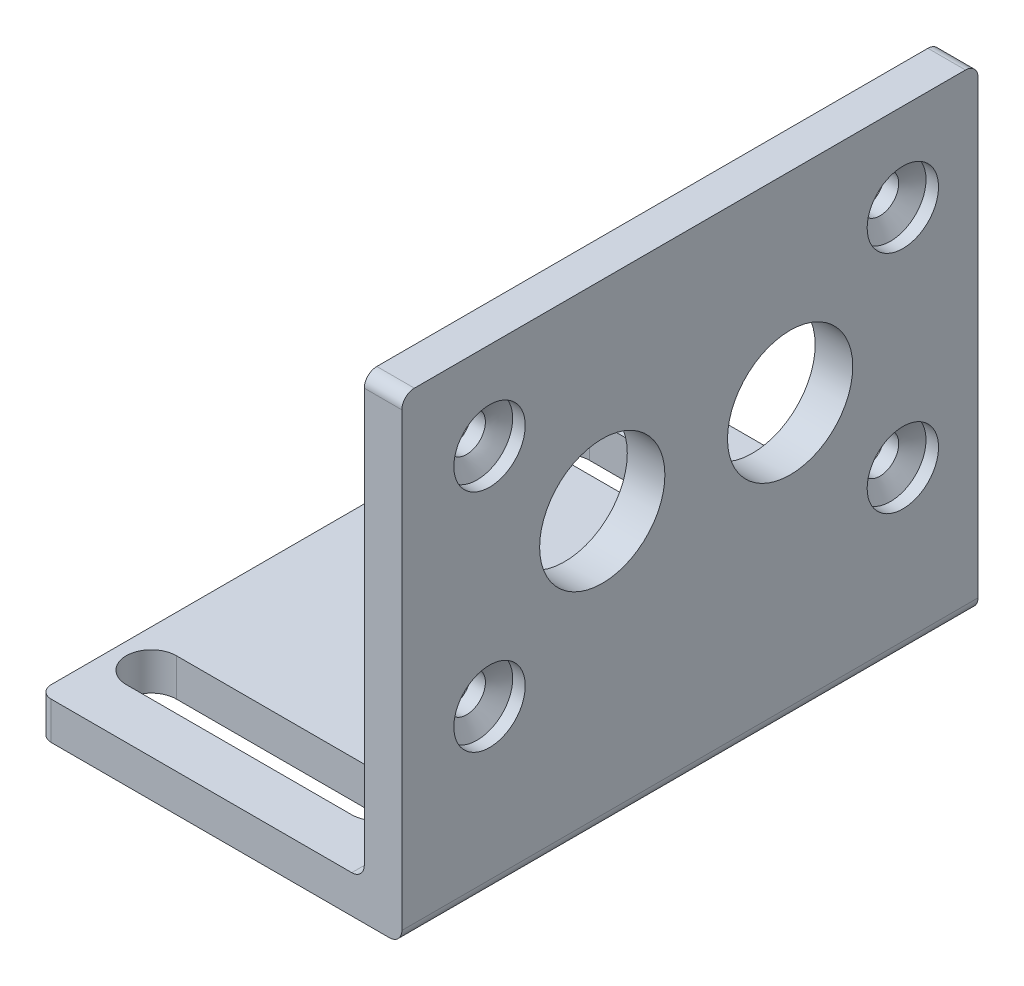
from build123d import *

# Parameters (mm, degrees)
SALIENTE_EXTRUIR1_DEPTH = 46
REDONDEO1_R             = 1
CROQUIS2_R              = 2.85
CROQUIS2_R_2            = 5
CORTAR_EXTRUIR1_DEPTH   = 1
CORTAR_EXTRUIR2_DEPTH   = 88.669687299
CROQUIS6_R              = 5
CORTAR_EXTRUIR3_DEPTH   = 65.306026243
CROQUIS7_3_R            = 1.5
CROQUIS7_5_R            = 1.5
CROQUIS7_6_R            = 1.5
CORTAR_EXTRUIR4_DEPTH   = 64.501763056


with BuildPart() as part:
    # Croquis1 → Saliente-Extruir1 (new body)
    with BuildSketch(Plane.XY):
        with BuildLine():
            Line((-36.916417311, 3.674134953), (-36.916417311, -33.325865047))
            ThreePointArc((-36.916417311, -33.325865047), (-37.20931053, -34.032971828), (-37.916417311, -34.325865047))
            Line((-37.916417311, -34.325865047), (-65.916417311, -34.325865047))
            Line((-65.916417311, -34.325865047), (-65.916417311, -31.325865047))
            Line((-65.916417311, -31.325865047), (-40.916417311, -31.325865047))
            ThreePointArc((-40.916417311, -31.325865047), (-40.20931053, -31.032971828), (-39.916417311, -30.325865047))
            Line((-39.916417311, -30.325865047), (-39.916417311, 3.674134953))
            Line((-39.916417311, 3.674134953), (-36.916417311, 3.674134953))
        make_face()
    extrude(amount=SALIENTE_EXTRUIR1_DEPTH)

    # Redondeo1
    redondeo1_edges = [part.edges().sort_by_distance(p)[0] for p in [
        (-38.416417311, 3.674134953, 0),
        (-65.916417311, -32.825865047, 46),
        (-38.416417311, 3.674134953, 46),
        (-65.916417311, -32.825865047, 0),
    ]]
    fillet(redondeo1_edges, radius=REDONDEO1_R)

    # Croquis2 → Cortar-Extruir1 (cut)
    with BuildSketch(Plane.ZY.offset(36.916417311)):
        with Locations((6, -3.325865047)):
            Circle(CROQUIS2_R)
        with Locations((39, -3.325865047)):
            Circle(CROQUIS2_R)
        with Locations((6, -21.325865047)):
            Circle(CROQUIS2_R)
        with Locations((39, -21.325865047)):
            Circle(CROQUIS2_R)
        with Locations((15, -12.325865047)):
            Circle(CROQUIS2_R_2)
        with Locations((30, -12.325865047)):
            Circle(CROQUIS2_R_2)
    extrude(amount=CORTAR_EXTRUIR1_DEPTH, mode=Mode.SUBTRACT)

    # Croquis3 → Cortar-Extruir2 (cut, through all)
    with BuildSketch(Plane(origin=(0, -31.325865047, 0), x_dir=(1, 0, 0), z_dir=(0, 1, 0))):
        with BuildLine():
            Line((-62.916417311, -42), (-44.916417311, -42))
            ThreePointArc((-44.916417311, -42), (-42.916417311, -40), (-44.916417311, -38))
            Line((-44.916417311, -38), (-62.916417311, -38))
            ThreePointArc((-62.916417311, -38), (-64.916417311, -40), (-62.916417311, -42))
        make_face()
        with BuildLine():
            Line((-62.916417311, -9), (-44.916417311, -9))
            ThreePointArc((-44.916417311, -9), (-42.916417311, -7), (-44.916417311, -5))
            Line((-44.916417311, -5), (-62.916417311, -5))
            ThreePointArc((-62.916417311, -5), (-64.916417311, -7), (-62.916417311, -9))
        make_face()
    extrude(amount=-CORTAR_EXTRUIR2_DEPTH, mode=Mode.SUBTRACT)

    # Croquis6 → Cortar-Extruir3 (cut, through all)
    with BuildSketch(Plane(origin=(-36.916417311, 0, 0), x_dir=(0, 0, -1), z_dir=(1, 0, 0))):
        with Locations((-30, -12.325865047)):
            Circle(CROQUIS6_R)
        with Locations((-15, -12.325865047)):
            Circle(CROQUIS6_R)
    extrude(amount=-CORTAR_EXTRUIR3_DEPTH, mode=Mode.SUBTRACT)

    # Cortar-Recubrir1: read off the stored shape, not the designer's step
    # Cortar-Recubrir1: loft between two sections, ruled curve by curve
    cortar_recubrir1_from = [
        Edge.make_bspline([(-37.916417311, -6.071519474, 38.235878437), (-37.916417311, -7.599762601, 43.727187292), (-37.916417311, -2.108453745, 45.255430419), (-37.916417311, -0.580210619, 39.764121563), (-37.916417311, 0.948032507, 34.272812708), (-37.916417311, -4.543276348, 32.744569581), (-37.916417311, -6.071519474, 38.235878437)], [0, 0, 0, 0, 0.5, 0.5, 0.5, 1, 1, 1, 1], 3, [1, 0.333333333, 0.333333333, 1, 0.333333333, 0.333333333, 1]),
    ]
    cortar_recubrir1_to = [
        Edge.make_bspline([(-38.746417311, -4.801032854, 39.271808645), (-38.746417311, -4.257415563, 42.22214426), (-38.746417311, -1.307079948, 41.67852697), (-38.746417311, -1.850697239, 38.728191355), (-38.746417311, -2.39431453, 35.77785574), (-38.746417311, -5.344650145, 36.32147303), (-38.746417311, -4.801032854, 39.271808645)], [0, 0, 0, 0, 0.5, 0.5, 0.5, 1, 1, 1, 1], 3, [1, 0.333333333, 0.333333333, 1, 0.333333333, 0.333333333, 1]),
    ]
    cortar_recubrir1 = Solid(Shell([*[Face.make_surface_from_curves(cortar_recubrir1_from[k], cortar_recubrir1_to[k]) for k in range(1)], Face(Wire(cortar_recubrir1_from)), Face(Wire(cortar_recubrir1_to))]))
    add(cortar_recubrir1, mode=Mode.SUBTRACT)

    # Croquis7<3> → section 1 of cortar_recubrir2
    with BuildSketch(Plane(origin=(-38.746417311, 0, 0), x_dir=(0, 0, -1), z_dir=(1, 0, 0)), mode=Mode.PRIVATE) as cortar_recubrir2_s1:
        with Locations((-39, -21.325865047)):
            Circle(CROQUIS7_3_R)
    # loft up to a face of the part (cortar_recubrir2)
    loft([Face(Wire([part.edges().sort_by_distance((-37.916417311, -23.403425635, 37.049040748))[0]])), cortar_recubrir2_s1.sketch], mode=Mode.SUBTRACT)

    # Cortar-Recubrir3: read off the stored shape, not the designer's step
    # Cortar-Recubrir3: loft between two sections, ruled curve by curve
    cortar_recubrir3_from = [
        Edge.make_bspline([(-37.916417311, -24.050926068, 6.834591174), (-37.916417311, -22.38174372, 12.284713218), (-37.916417311, -16.931621677, 10.615530869), (-37.916417311, -18.600804025, 5.165408826), (-37.916417311, -20.269986373, -0.284713218), (-37.916417311, -25.720108417, 1.384469131), (-37.916417311, -24.050926068, 6.834591174)], [0, 0, 0, 0, 0.5, 0.5, 0.5, 1, 1, 1, 1], 3, [1, 0.333333333, 0.333333333, 1, 0.333333333, 0.333333333, 1]),
    ]
    cortar_recubrir3_to = [
        Edge.make_bspline([(-38.746417311, -22.643490638, 6.716842243), (-38.746417311, -21.209806151, 9.352093425), (-38.746417311, -18.574554969, 7.918408939), (-38.746417311, -20.008239456, 5.283157757), (-38.746417311, -21.441923942, 2.647906575), (-38.746417311, -24.077175124, 4.081591061), (-38.746417311, -22.643490638, 6.716842243)], [0, 0, 0, 0, 0.5, 0.5, 0.5, 1, 1, 1, 1], 3, [1, 0.333333333, 0.333333333, 1, 0.333333333, 0.333333333, 1]),
    ]
    cortar_recubrir3 = Solid(Shell([*[Face.make_surface_from_curves(cortar_recubrir3_from[k], cortar_recubrir3_to[k]) for k in range(1)], Face(Wire(cortar_recubrir3_from)), Face(Wire(cortar_recubrir3_to))]))
    add(cortar_recubrir3, mode=Mode.SUBTRACT)

    # Croquis7<5> → section 1 of cortar_recubrir4
    with BuildSketch(Plane(origin=(-38.746417311, 0, 0), x_dir=(0, 0, -1), z_dir=(1, 0, 0)), mode=Mode.PRIVATE) as cortar_recubrir4_s1:
        with Locations((-6, -3.325865047)):
            Circle(CROQUIS7_5_R)
    # loft up to a face of the part (cortar_recubrir4)
    loft([Face(Wire([part.edges().sort_by_distance((-37.916417311, -5.403425635, 4.049040748))[0]])), cortar_recubrir4_s1.sketch], mode=Mode.SUBTRACT)

    # Croquis7<6> → Cortar-Extruir4 (cut, through all)
    with BuildSketch(Plane(origin=(-38.746417311, 0, 0), x_dir=(0, 0, -1), z_dir=(1, 0, 0))):
        with Locations((-39, -3.325865047)):
            Circle(CROQUIS7_6_R)
        with Locations((-39, -21.325865047)):
            Circle(CROQUIS7_6_R)
        with Locations((-6, -21.325865047)):
            Circle(CROQUIS7_6_R)
        with Locations((-6, -3.325865047)):
            Circle(CROQUIS7_6_R)
    extrude(amount=-CORTAR_EXTRUIR4_DEPTH, mode=Mode.SUBTRACT)


solid = part.part
